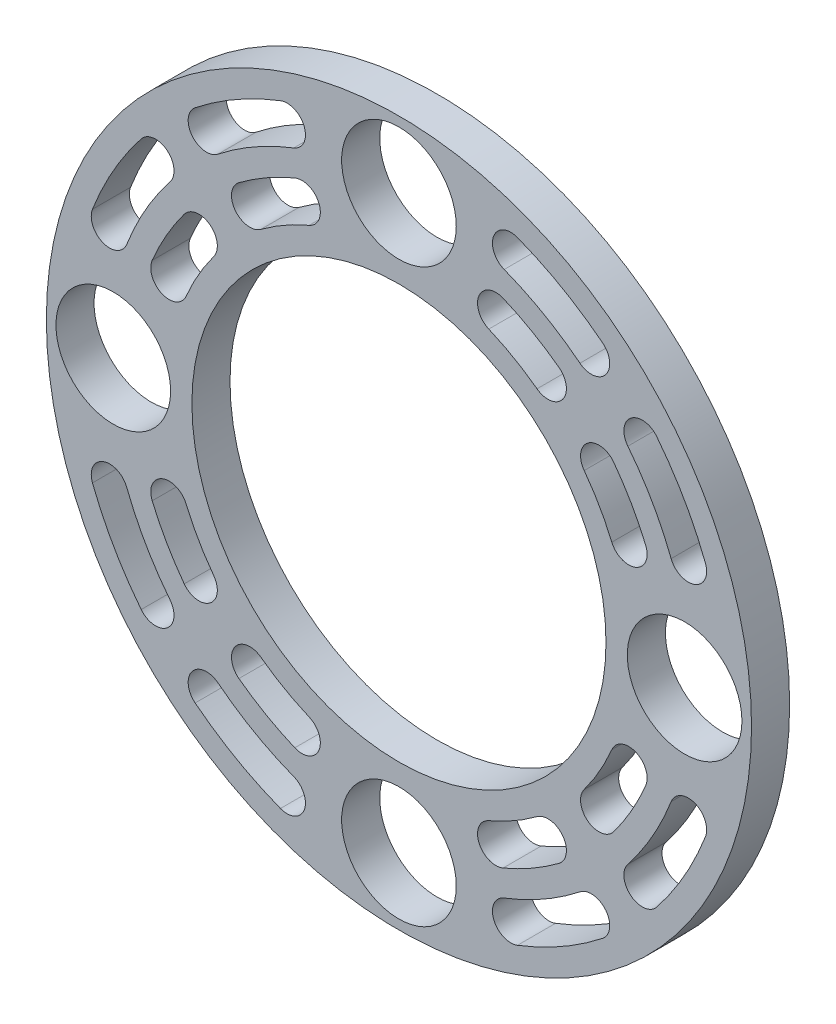
from build123d import *

# Parameters (mm, degrees)
SKETCH6_R           = 58.75
SKETCH6_R_2         = 34.5
BOSS_EXTRUDE1_DEPTH = 6.35
SKETCH5_R           = 9.55
CUT_EXTRUDE1_DEPTH  = 84.327351452
CUT_EXTRUDE3_DEPTH  = 84.327351452


with BuildPart() as part:
    # Sketch6 → Boss-Extrude1 (new body)
    with BuildSketch(Plane.XY):
        Circle(SKETCH6_R)
        Circle(SKETCH6_R_2, mode=Mode.SUBTRACT)
    extrude(amount=BOSS_EXTRUDE1_DEPTH)

    # Sketch5 → Cut-Extrude1 (cut, through all)
    with BuildSketch(Plane.XY):
        with Locations((0, 47.6)):
            Circle(SKETCH5_R)
        with Locations((47.6, 0)):
            Circle(SKETCH5_R)
        with Locations((0, -47.6)):
            Circle(SKETCH5_R)
        with Locations((-47.6, 0)):
            Circle(SKETCH5_R)
    extrude(amount=CUT_EXTRUDE1_DEPTH, mode=Mode.SUBTRACT)

    # Sketch9 → Cut-Extrude3 (cut, through all)
    with BuildSketch(Plane.XY):
        with BuildLine():
            ThreePointArc((33.958355337, 42.946392198), (27.156576229, 47.540328854), (19.744469053, 51.065824597))
            ThreePointArc((19.744469053, 51.065824597), (15.783619294, 49.313830965), (17.535612926, 45.352981206))
            ThreePointArc((17.535612926, 45.352981206), (24.118511765, 42.221890237), (30.159361247, 38.141887135))
            ThreePointArc((30.159361247, 38.141887135), (34.461110824, 38.644642621), (33.958355337, 42.946392198))
        make_face()
        with BuildLine():
            ThreePointArc((51.065824597, 19.744469053), (47.540328854, 27.156576229), (42.946392198, 33.958355337))
            ThreePointArc((42.946392198, 33.958355337), (38.644642621, 34.461110824), (38.141887135, 30.159361247))
            ThreePointArc((38.141887135, 30.159361247), (42.221890237, 24.118511765), (45.352981206, 17.535612926))
            ThreePointArc((45.352981206, 17.535612926), (49.313830965, 15.783619294), (51.065824597, 19.744469053))
        make_face()
        with BuildLine():
            ThreePointArc((26.668852196, 35.779364829), (22.171350506, 38.72753338), (17.351873742, 41.113295935))
            ThreePointArc((17.351873742, 41.113295935), (13.339558176, 39.482610098), (14.970244012, 35.470294532))
            ThreePointArc((14.970244012, 35.470294532), (19.128223966, 33.411989583), (23.008421502, 30.868471617))
            ThreePointArc((23.008421502, 30.868471617), (27.294083455, 31.493702876), (26.668852196, 35.779364829))
        make_face()
        with BuildLine():
            ThreePointArc((41.113295935, 17.351873742), (38.72753338, 22.171350506), (35.779364829, 26.668852196))
            ThreePointArc((35.779364829, 26.668852196), (31.493702876, 27.294083455), (30.868471617, 23.008421502))
            ThreePointArc((30.868471617, 23.008421502), (33.411989583, 19.128223966), (35.470294532, 14.970244012))
            ThreePointArc((35.470294532, 14.970244012), (39.482610098, 13.339558176), (41.113295935, 17.351873742))
        make_face()
        with BuildLine():
            ThreePointArc((-33.958355337, 42.946392198), (-27.156576229, 47.540328854), (-19.744469053, 51.065824597))
            ThreePointArc((-19.744469053, 51.065824597), (-15.783619294, 49.313830965), (-17.535612926, 45.352981206))
            ThreePointArc((-17.535612926, 45.352981206), (-24.118511765, 42.221890237), (-30.159361247, 38.141887135))
            ThreePointArc((-30.159361247, 38.141887135), (-34.461110824, 38.644642621), (-33.958355337, 42.946392198))
        make_face()
        with BuildLine():
            ThreePointArc((-51.065824597, 19.744469053), (-47.540328854, 27.156576229), (-42.946392198, 33.958355337))
            ThreePointArc((-42.946392198, 33.958355337), (-38.644642621, 34.461110824), (-38.141887135, 30.159361247))
            ThreePointArc((-38.141887135, 30.159361247), (-42.221890237, 24.118511765), (-45.352981206, 17.535612926))
            ThreePointArc((-45.352981206, 17.535612926), (-49.313830965, 15.783619294), (-51.065824597, 19.744469053))
        make_face()
        with BuildLine():
            ThreePointArc((-26.668852196, 35.779364829), (-22.171350506, 38.72753338), (-17.351873742, 41.113295935))
            ThreePointArc((-17.351873742, 41.113295935), (-13.339558176, 39.482610098), (-14.970244012, 35.470294532))
            ThreePointArc((-14.970244012, 35.470294532), (-19.128223966, 33.411989583), (-23.008421502, 30.868471617))
            ThreePointArc((-23.008421502, 30.868471617), (-27.294083455, 31.493702876), (-26.668852196, 35.779364829))
        make_face()
        with BuildLine():
            ThreePointArc((-41.113295935, 17.351873742), (-38.72753338, 22.171350506), (-35.779364829, 26.668852196))
            ThreePointArc((-35.779364829, 26.668852196), (-31.493702876, 27.294083455), (-30.868471617, 23.008421502))
            ThreePointArc((-30.868471617, 23.008421502), (-33.411989583, 19.128223966), (-35.470294532, 14.970244012))
            ThreePointArc((-35.470294532, 14.970244012), (-39.482610098, 13.339558176), (-41.113295935, 17.351873742))
        make_face()
        with BuildLine():
            ThreePointArc((-33.958355337, -42.946392198), (-27.156576229, -47.540328854), (-19.744469053, -51.065824597))
            ThreePointArc((-19.744469053, -51.065824597), (-15.783619294, -49.313830965), (-17.535612926, -45.352981206))
            ThreePointArc((-17.535612926, -45.352981206), (-24.118511765, -42.221890237), (-30.159361247, -38.141887135))
            ThreePointArc((-30.159361247, -38.141887135), (-34.461110824, -38.644642621), (-33.958355337, -42.946392198))
        make_face()
        with BuildLine():
            ThreePointArc((-51.065824597, -19.744469053), (-47.540328854, -27.156576229), (-42.946392198, -33.958355337))
            ThreePointArc((-42.946392198, -33.958355337), (-38.644642621, -34.461110824), (-38.141887135, -30.159361247))
            ThreePointArc((-38.141887135, -30.159361247), (-42.221890237, -24.118511765), (-45.352981206, -17.535612926))
            ThreePointArc((-45.352981206, -17.535612926), (-49.313830965, -15.783619294), (-51.065824597, -19.744469053))
        make_face()
        with BuildLine():
            ThreePointArc((-26.668852196, -35.779364829), (-22.171350506, -38.72753338), (-17.351873742, -41.113295935))
            ThreePointArc((-17.351873742, -41.113295935), (-13.339558176, -39.482610098), (-14.970244012, -35.470294532))
            ThreePointArc((-14.970244012, -35.470294532), (-19.128223966, -33.411989583), (-23.008421502, -30.868471617))
            ThreePointArc((-23.008421502, -30.868471617), (-27.294083455, -31.493702876), (-26.668852196, -35.779364829))
        make_face()
        with BuildLine():
            ThreePointArc((-41.113295935, -17.351873742), (-38.72753338, -22.171350506), (-35.779364829, -26.668852196))
            ThreePointArc((-35.779364829, -26.668852196), (-31.493702876, -27.294083455), (-30.868471617, -23.008421502))
            ThreePointArc((-30.868471617, -23.008421502), (-33.411989583, -19.128223966), (-35.470294532, -14.970244012))
            ThreePointArc((-35.470294532, -14.970244012), (-39.482610098, -13.339558176), (-41.113295935, -17.351873742))
        make_face()
        with BuildLine():
            ThreePointArc((33.958355337, -42.946392198), (27.156576229, -47.540328854), (19.744469053, -51.065824597))
            ThreePointArc((19.744469053, -51.065824597), (15.783619294, -49.313830965), (17.535612926, -45.352981206))
            ThreePointArc((17.535612926, -45.352981206), (24.118511765, -42.221890237), (30.159361247, -38.141887135))
            ThreePointArc((30.159361247, -38.141887135), (34.461110824, -38.644642621), (33.958355337, -42.946392198))
        make_face()
        with BuildLine():
            ThreePointArc((26.668852196, -35.779364829), (22.171350506, -38.72753338), (17.351873742, -41.113295935))
            ThreePointArc((17.351873742, -41.113295935), (13.339558176, -39.482610098), (14.970244012, -35.470294532))
            ThreePointArc((14.970244012, -35.470294532), (19.128223966, -33.411989583), (23.008421502, -30.868471617))
            ThreePointArc((23.008421502, -30.868471617), (27.294083455, -31.493702876), (26.668852196, -35.779364829))
        make_face()
        with BuildLine():
            ThreePointArc((41.113295935, -17.351873742), (38.72753338, -22.171350506), (35.779364829, -26.668852196))
            ThreePointArc((35.779364829, -26.668852196), (31.493702876, -27.294083455), (30.868471617, -23.008421502))
            ThreePointArc((30.868471617, -23.008421502), (33.411989583, -19.128223966), (35.470294532, -14.970244012))
            ThreePointArc((35.470294532, -14.970244012), (39.482610098, -13.339558176), (41.113295935, -17.351873742))
        make_face()
        with BuildLine():
            ThreePointArc((51.065824597, -19.744469053), (47.540328854, -27.156576229), (42.946392198, -33.958355337))
            ThreePointArc((42.946392198, -33.958355337), (38.644642621, -34.461110824), (38.141887135, -30.159361247))
            ThreePointArc((38.141887135, -30.159361247), (42.221890237, -24.118511765), (45.352981206, -17.535612926))
            ThreePointArc((45.352981206, -17.535612926), (49.313830965, -15.783619294), (51.065824597, -19.744469053))
        make_face()
    extrude(amount=CUT_EXTRUDE3_DEPTH, mode=Mode.SUBTRACT)


solid = part.part
